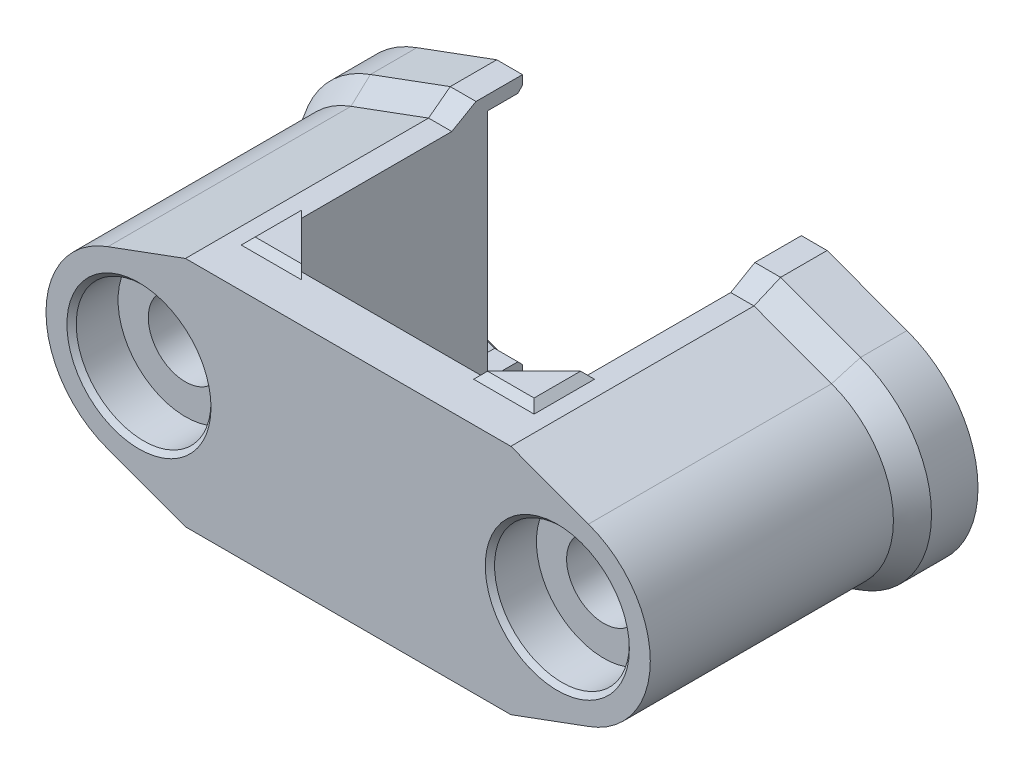
from build123d import *
from OCP.BRepFilletAPI import BRepFilletAPI_MakeChamfer

# Parameters (mm, degrees)
SKIZZE2_R                            = 1.6
AUFSATZ_LINEAR_AUSTRAGEN1_DEPTH      = 12
SCHNITT_LINEAR_AUSTRAGEN1_DEPTH      = 19.384776311
SCHNITT_LINEAR_AUSTRAGEN1_DEPTH_BACK = 19.384776311
SKIZZE3_W                            = 12
SKIZZE3_H                            = 10
AUFSATZ_LINEAR_AUSTRAGEN2_DEPTH      = 12
AUFSATZ_LINEAR_START                 = -0.2
AUFSATZ_LINEAR_AUSTRAGEN3_DEPTH      = 0.5
FASE3_SIZE                           = 0.3
AUFSATZ_LINEAR_AUSTRAGEN4_DEPTH      = 2
FASE1_SIZE                           = 0.6
FASE1_SIZE_2                         = 1.039230485
SKIZZE7_R                            = 2.9
SCHNITT_LINEAR_AUSTRAGEN2_DEPTH      = 2
FASE2_SIZE                           = 0.2


with BuildPart() as part:
    # Skizze2 → Aufsatz-Linear austragen1 (new body)
    with BuildSketch(Plane.XY):
        with BuildLine():
            Line((-6, -2.645751311), (-6, -5))
            Line((-6, -5), (6, -5))
            Line((6, -5), (6, -2.645751311))
            ThreePointArc((6, -2.645751311), (13, 0), (6, 2.645751311))
            Line((6, 2.645751311), (6, 5))
            Line((6, 5), (-6, 5))
            Line((-6, 5), (-6, 2.645751311))
            ThreePointArc((-6, 2.645751311), (-13, 0), (-6, -2.645751311))
        make_face()
        with Locations((-9, 0)):
            Circle(SKIZZE2_R, mode=Mode.SUBTRACT)
        with Locations(Location((9, 0, 0), (0, 0, 180))):
            Circle(SKIZZE2_R, mode=Mode.SUBTRACT)
    extrude(amount=AUFSATZ_LINEAR_AUSTRAGEN1_DEPTH)

    # Skizze3 → Schnitt-Linear austragen1 (cut, two sides: drawn at the far end of the back side and taken through both)
    with BuildSketch(Plane(origin=(0, 0, 0), x_dir=(-1, 0, 0), z_dir=(0, -1, 0)).offset(-SCHNITT_LINEAR_AUSTRAGEN1_DEPTH_BACK)):
        with Locations((0, -5)):
            Rectangle(SKIZZE3_W, SKIZZE3_H)
    extrude(amount=SCHNITT_LINEAR_AUSTRAGEN1_DEPTH + SCHNITT_LINEAR_AUSTRAGEN1_DEPTH_BACK, mode=Mode.SUBTRACT)

    # Skizze4 → Aufsatz-Linear austragen2 (add, through all)
    with BuildSketch(Plane.XY.offset(12)):
        with BuildLine():
            Line((-6, 2.645751311), (-6, 5))
            Line((-6, 5), (-7, 5))
            Line((-7, 5), (-10.338485005, 3.769410815))
            ThreePointArc((-10.338485005, 3.769410815), (-7.997098863, 3.872233117), (-6, 2.645751311))
        make_face()
        with BuildLine():
            ThreePointArc((-6, -2.645751311), (-7.997098863, -3.872233117), (-10.338485005, -3.769410815))
            Line((-10.338485005, -3.769410815), (-7, -5))
            Line((-7, -5), (-6, -5))
            Line((-6, -5), (-6, -2.645751311))
        make_face()
        with BuildLine():
            ThreePointArc((6, 2.645751311), (7.997098863, 3.872233117), (10.338485005, 3.769410815))
            Line((10.338485005, 3.769410815), (7, 5))
            Line((7, 5), (6, 5))
            Line((6, 5), (6, 2.645751311))
        make_face()
        with BuildLine():
            Line((6, -2.645751311), (6, -5))
            Line((6, -5), (7, -5))
            Line((7, -5), (10.338485005, -3.769410815))
            ThreePointArc((10.338485005, -3.769410815), (7.997098863, -3.872233117), (6, -2.645751311))
        make_face()
    extrude(amount=-AUFSATZ_LINEAR_AUSTRAGEN2_DEPTH)

    # Skizze5 → Aufsatz-Linear austragen3 (add)
    with BuildSketch(Plane.XZ.offset(5).offset(AUFSATZ_LINEAR_START)):
        Polygon((-6, 10), (-4, 10), (-6, 8), align=None)
        Polygon((6, 8), (6, 10), (4, 10), align=None)
    aufsatz_linear_austragen3 = extrude(amount=AUFSATZ_LINEAR_AUSTRAGEN3_DEPTH)

    # Spiegeln1: Aufsatz-Linear austragen3 across plane
    add(aufsatz_linear_austragen3.mirror(Plane(origin=(0, 0, 0), x_dir=(0, 0, 1), z_dir=(0, -1, 0))))

    # Fase3
    fase3_edges = [part.edges().sort_by_distance(p)[0] for p in [
        (6, -5, 9),
        (5, -5, 10),
        (-6, -5, 9),
        (-5, -5, 10),
        (6, 5, 9),
        (5, 5, 10),
        (-5, 5, 10),
        (-6, 5, 9),
    ]]
    chamfer(fase3_edges, length=FASE3_SIZE - 0.0001)  # a hair under: the kernel refuses the full size

    # Skizze6 → Aufsatz-Linear austragen4 (add)
    with BuildSketch(Plane(origin=(0, 0, -1.5), x_dir=(-1, 0, 0), z_dir=(0, 0, -1))):
        with BuildLine():
            Line((6, -5), (7, -5))
            Line((7, -5), (10.338485005, -3.769410815))
            ThreePointArc((10.338485005, -3.769410815), (13, 0), (10.338485005, 3.769410815))
            Line((10.338485005, 3.769410815), (7, 5))
            Line((7, 5), (6, 5))
            Line((6, 5), (6, 5.6))
            Line((6, 5.6), (7.107061274, 5.6))
            Line((7.107061274, 5.6), (10.542753877, 4.333579407))
            ThreePointArc((10.542753877, 4.333579407), (13.6, 0), (10.542753877, -4.333579407))
            Line((10.542753877, -4.333579407), (7.107061274, -5.6))
            Line((7.107061274, -5.6), (6, -5.6))
            Line((6, -5.6), (6, -5))
        make_face()
        with BuildLine():
            Line((-6, -5), (-6, -5.6))
            Line((-6, -5.6), (-7.107061274, -5.6))
            Line((-7.107061274, -5.6), (-10.542753877, -4.333579407))
            ThreePointArc((-10.542753877, -4.333579407), (-13.6, 0), (-10.542753877, 4.333579407))
            Line((-10.542753877, 4.333579407), (-7.107061274, 5.6))
            Line((-7.107061274, 5.6), (-6, 5.6))
            Line((-6, 5.6), (-6, 5))
            Line((-6, 5), (-7, 5))
            Line((-7, 5), (-10.338485005, 3.769410815))
            ThreePointArc((-10.338485005, 3.769410815), (-13, 0), (-10.338485005, -3.769410815))
            Line((-10.338485005, -3.769410815), (-7, -5))
            Line((-7, -5), (-6, -5))
        make_face()
    extrude(amount=-AUFSATZ_LINEAR_AUSTRAGEN4_DEPTH)

    # Fase1
    fase1_edges_1 = [part.edges().sort_by_distance(p)[0] for p in [
        (-6.5, -5, 0.5),
    ]]
    fase1_side_1 = [part.faces().sort_by_distance(p)[0] for p in [
        (-6.5, -5.012, 0.5),
    ]]
    fase1_edges_2 = [part.edges().sort_by_distance(p)[0] for p in [
        (-8.669242502, -4.384705408, 0.5),
    ]]
    fase1_side_2 = [part.faces().sort_by_distance(p)[0] for p in [
        (-8.673392811, -4.395964845, 0.5),
    ]]
    fase1_edges_3 = [part.edges().sort_by_distance(p)[0] for p in [
        (-8.669242502, 4.384705408, 0.5),
    ]]
    fase1_side_3 = [part.faces().sort_by_distance(p)[0] for p in [
        (-8.673392811, 4.395964845, 0.5),
    ]]
    fase1_edges_4 = [part.edges().sort_by_distance(p)[0] for p in [
        (-6.5, 5, 0.5),
    ]]
    fase1_side_4 = [part.faces().sort_by_distance(p)[0] for p in [
        (-6.5, 5, 0.512),
    ]]
    fase1_edges_5 = [part.edges().sort_by_distance(p)[0] for p in [
        (6.5, 5, 0.5),
    ]]
    fase1_side_5 = [part.faces().sort_by_distance(p)[0] for p in [
        (6.5, 5, 0.512),
    ]]
    fase1_edges_6 = [part.edges().sort_by_distance(p)[0] for p in [
        (8.669242502, 4.384705408, 0.5),
    ]]
    fase1_side_6 = [part.faces().sort_by_distance(p)[0] for p in [
        (8.669242502, 4.384705408, 0.512),
    ]]
    fase1_edges_7 = [part.edges().sort_by_distance(p)[0] for p in [
        (8.669242502, -4.384705408, 0.5),
    ]]
    fase1_side_7 = [part.faces().sort_by_distance(p)[0] for p in [
        (8.673392811, -4.395964845, 0.5),
    ]]
    fase1_edges_8 = [part.edges().sort_by_distance(p)[0] for p in [
        (6.5, -5, 0.5),
    ]]
    fase1_side_8 = [part.faces().sort_by_distance(p)[0] for p in [
        (6.5, -5.012, 0.5),
    ]]
    fase1 = BRepFilletAPI_MakeChamfer(part.part.solid().wrapped)
    for e in fase1_edges_1:
        fase1.Add(FASE1_SIZE - 0.0001, FASE1_SIZE_2 - 0.0001, e.wrapped, fase1_side_1[0].wrapped)
    for e in fase1_edges_2:
        fase1.Add(FASE1_SIZE - 0.0001, FASE1_SIZE_2 - 0.0001, e.wrapped, fase1_side_2[0].wrapped)
    for e in fase1_edges_3:
        fase1.Add(FASE1_SIZE - 0.0001, FASE1_SIZE_2 - 0.0001, e.wrapped, fase1_side_3[0].wrapped)
    for e in fase1_edges_4:
        fase1.Add(FASE1_SIZE_2 - 0.0001, FASE1_SIZE - 0.0001, e.wrapped, fase1_side_4[0].wrapped)
    for e in fase1_edges_5:
        fase1.Add(FASE1_SIZE_2 - 0.0001, FASE1_SIZE - 0.0001, e.wrapped, fase1_side_5[0].wrapped)
    for e in fase1_edges_6:
        fase1.Add(FASE1_SIZE_2 - 0.0001, FASE1_SIZE - 0.0001, e.wrapped, fase1_side_6[0].wrapped)
    for e in fase1_edges_7:
        fase1.Add(FASE1_SIZE - 0.0001, FASE1_SIZE_2 - 0.0001, e.wrapped, fase1_side_7[0].wrapped)
    for e in fase1_edges_8:
        fase1.Add(FASE1_SIZE - 0.0001, FASE1_SIZE_2 - 0.0001, e.wrapped, fase1_side_8[0].wrapped)
    add(Compound.cast(fase1.Shape()), mode=Mode.REPLACE)  # a hair under: the kernel refuses the full size

    # Skizze7 → Schnitt-Linear austragen2 (cut)
    with BuildSketch(Plane.XY.offset(12)):
        with Locations((-9, 0)):
            Circle(SKIZZE7_R)
        with Locations((9, 0)):
            Circle(SKIZZE7_R)
    extrude(amount=-SCHNITT_LINEAR_AUSTRAGEN2_DEPTH, mode=Mode.SUBTRACT)

    # Fase2
    fase2_edges = [part.edges().sort_by_distance(p)[0] for p in [
        (-6.5, -5, -1.5),
        (-8.669242502, -4.384705408, -1.5),
        (-8.669242502, 4.384705408, -1.5),
        (-6.5, 5, -1.5),
        (6.5, -5, -1.5),
        (8.669242502, -4.384705408, -1.5),
        (13, 0, -1.5),
        (8.669242502, 4.384705408, -1.5),
        (6.5, 5, -1.5),
        (10.6, 0, 0),
        (-10.6, 0, 0),
        (-11.9, 0, 12),
        (6.1, 0, 12),
    ]]
    chamfer(fase2_edges, length=FASE2_SIZE)


solid = part.part
